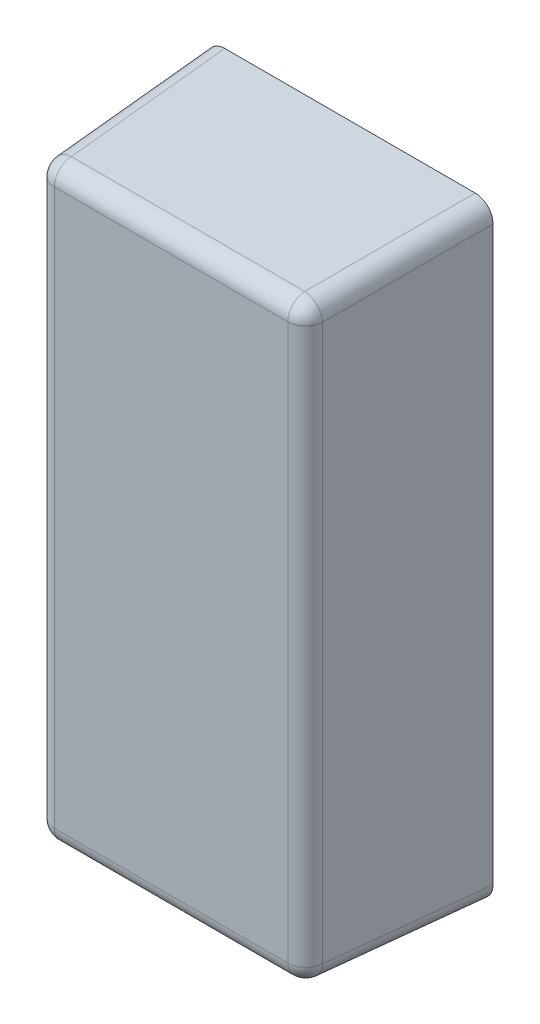
from build123d import *

# Parameters (mm, degrees)
ESQUISSE1_W        = 16
ESQUISSE1_H        = 34
BOSS_EXTRU_1_DEPTH = 10
BOSS_EXTRU_1_TAPER = 3
CONG_1_R           = 1
COQUE1_OUTLINE_W   = 13.05391528
COQUE1_OUTLINE_H   = 31.05391528
COQUE1_DEPTH       = 9
COQUE1_DRAFT       = 3
ESQUISSE2_R        = 3
ESQUISSE2_R_2      = 1.5
BOSS_EXTRU_2_DEPTH = 9


# Read off the part's stored shape, not the designer's step: Coque1
with BuildPart() as part:
    # Esquisse1 → Boss.-Extru.1 (new body)
    with BuildSketch(Plane.XY):
        Rectangle(ESQUISSE1_W, ESQUISSE1_H)
    extrude(amount=BOSS_EXTRU_1_DEPTH, taper=BOSS_EXTRU_1_TAPER)

    # Congé1
    cong_1_edges = [part.edges().sort_by_distance(p)[0] for p in [
        (7.475922207, 0, 10),
        (0, 16.475922207, 10),
        (-7.475922207, 0, 10),
        (-7.737960642, 16.737960642, 5.000008814),
        (7.737961104, 16.737961104, 5),
        (7.737960642, -16.737960642, 5.000008814),
        (-7.737961104, -16.737961104, 5),
        (0, -16.475922207, 10),
    ]]
    fillet(cong_1_edges, radius=CONG_1_R)


with BuildPart() as coque1_tool:
    # Coque1 outline → Coque1 (with draft: the straight prism first)
    with BuildSketch(Plane.XY.offset(9)):
        Rectangle(COQUE1_OUTLINE_W, COQUE1_OUTLINE_H)
    extrude(amount=-COQUE1_DEPTH)
    # Coque1: the draft: its side faces are tilted about the plane it starts from
    coque1_sides = [coque1_tool.faces().sort_by_distance(p)[0] for p in [
        (-6.52695764, 0, 4.5),
        (0, -15.52695764, 4.5),
        (6.52695764, 0, 4.5),
        (0, 15.52695764, 4.5),
    ]]
    draft(coque1_sides, Plane.XY.offset(9), COQUE1_DRAFT)


with BuildPart() as part_1:
    add(part.part)

    # Coque1: cut by coque1_tool
    add(coque1_tool.part, mode=Mode.SUBTRACT)

    # Esquisse2 → Boss.-Extru.2 (add)
    with BuildSketch(Plane(origin=(0, 0, 9), x_dir=(-1, 0, 0), z_dir=(0, 0, -1))):
        with Locations(Location((0, 0, 0), (0, 0, 180))):
            Circle(ESQUISSE2_R)
        with Locations(Location((0, 0, 0), (0, 0, 180))):
            Circle(ESQUISSE2_R_2, mode=Mode.SUBTRACT)
    extrude(amount=BOSS_EXTRU_2_DEPTH)


solid = part_1.part
